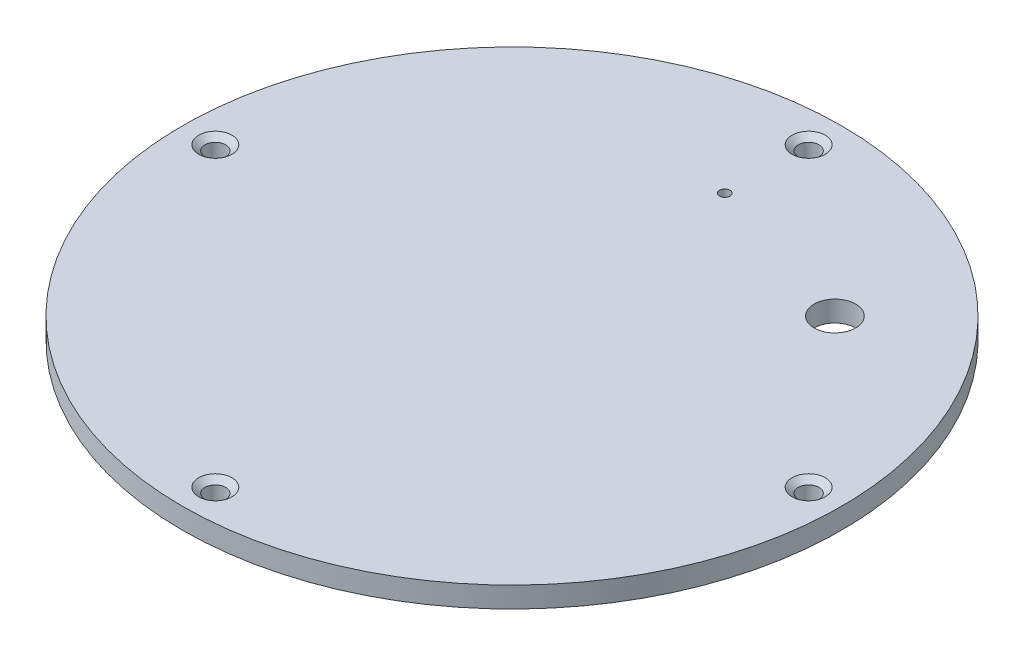
from build123d import *

# Parameters (mm, degrees)
SKETCH1_R                                       = 15.875
BOSS_EXTRUDE1_DEPTH                             = 1
CUT_EXTRUDE1_DEPTH                              = 23.472900347
CUT_EXTRUDE1_DEPTH_BACK                         = 23.472900347
SKETCH6_R                                       = 0.25
SKETCH6_R_2                                     = 1
CSK_FOR_M2_FLAT_HEAD_MACHINE_SCREW1_D           = 1
CSK_FOR_M2_FLAT_HEAD_MACHINE_SCREW1_CSINK_D     = 1.6
CSK_FOR_M2_FLAT_HEAD_MACHINE_SCREW1_CSINK_ANGLE = 100


with BuildPart() as part:
    # Sketch1 → Boss-Extrude1 (new body)
    with BuildSketch(Plane(origin=(0, 0, 0), x_dir=(1, 0, 0), z_dir=(0, 1, 0))):
        Circle(SKETCH1_R)
    extrude(amount=BOSS_EXTRUDE1_DEPTH)

    # Sketch6 → Cut-Extrude1 (cut, two sides: drawn at the far end of the back side and taken through both)
    with BuildSketch(Plane(origin=(0, 1, 0), x_dir=(1, 0, 0), z_dir=(0, 1, 0)).offset(-CUT_EXTRUDE1_DEPTH_BACK)):
        with Locations((0, 10.25)):
            Circle(SKETCH6_R)
        with Locations((7.778174593, 7.778174593)):
            Circle(SKETCH6_R_2)
    extrude(amount=CUT_EXTRUDE1_DEPTH + CUT_EXTRUDE1_DEPTH_BACK, mode=Mode.SUBTRACT)

    # CSK for M2 Flat Head Machine Screw1 (through all)
    with Locations(Plane(origin=(0, 1, 0), x_dir=(1, 0, 0), z_dir=(0, 1, 0))):
        with Locations((0, 14.29), (-14.29, 0), (0, -14.29), (14.29, 0)):
            CounterSinkHole(CSK_FOR_M2_FLAT_HEAD_MACHINE_SCREW1_D / 2, CSK_FOR_M2_FLAT_HEAD_MACHINE_SCREW1_CSINK_D / 2, counter_sink_angle=CSK_FOR_M2_FLAT_HEAD_MACHINE_SCREW1_CSINK_ANGLE)


solid = part.part
